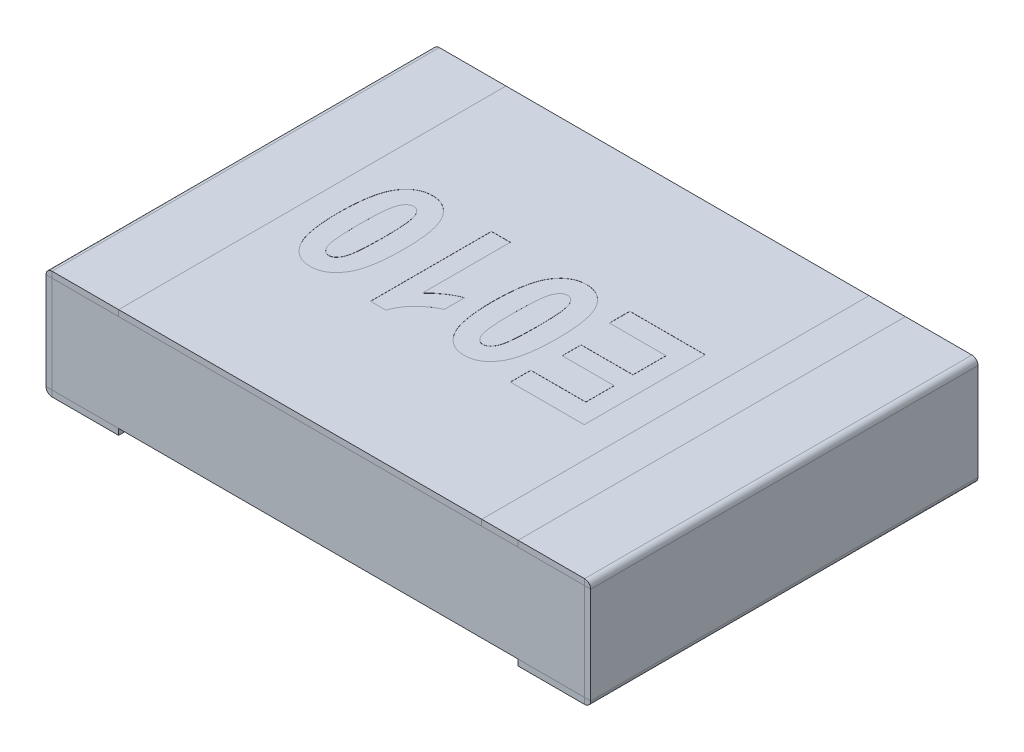
from build123d import *

# Parameters (mm, degrees)
SKETCH1_W              = 4.4
SKETCH1_H              = 3.2
BOSS_EXTRUDE1_DEPTH    = 0.8
SKETCH2_W              = 0.55
SKETCH2_H              = 3.2
BASE_FLANGE1_DEPTH     = 0.05
SM_START               = -1.6
SM_EDGE_FLANGE_1_DEPTH = 3.2
SM_EDGE_FLANGE_2_DEPTH = 3.2
SKETCH17_W             = 0.3
SKETCH17_H             = 3.2
BOSS_EXTRUDE3_DEPTH    = 0.05
SKETCH19_W             = 3
SKETCH19_H             = 3.2
BOSS_EXTRUDE4_DEPTH    = 0.05
CUT_EXTRUDE3_DEPTH     = 0.001


# Read off the part's stored shape, not the designer's step: Ребро-кромка1, Ребро-кромка2
# Sheet-metal steps are written as plain solids
with BuildPart() as part:
    # Sketch1 → Boss-Extrude1 (new body)
    with BuildSketch(Plane(origin=(0, 0.05, 0), x_dir=(1, 0, 0), z_dir=(0, 1, 0))):
        Rectangle(SKETCH1_W, SKETCH1_H)
    extrude(amount=BOSS_EXTRUDE1_DEPTH)


with BuildPart() as body_2:
    # Sketch2 → Base-Flange1 (new body)
    with BuildSketch(Plane(origin=(0, 0.05, 0), x_dir=(1, 0, 0), z_dir=(0, 1, 0))):
        with Locations((1.925, 0)):
            Rectangle(SKETCH2_W, SKETCH2_H)
    extrude(amount=-BASE_FLANGE1_DEPTH)

    # Ребро-кромка1 outline → Ребро-кромка1 (add)
    with BuildSketch(Plane.XY.offset(SM_START)):
        with BuildLine():
            Line((2.2, 0.85), (2.2, 0))
            ThreePointArc((2.2, 0), (2.235355339, 0.014644661), (2.25, 0.05))
            Line((2.25, 0.05), (2.25, 0.85))
            Line((2.25, 0.85), (2.2, 0.85))
        make_face()
    extrude(amount=SM_EDGE_FLANGE_1_DEPTH)

    # Ребро-кромка2 outline → Ребро-кромка2 (add)
    with BuildSketch(Plane.XY.offset(SM_START)):
        with BuildLine():
            Line((1.65, 0.9), (1.65, 0.85))
            Line((1.65, 0.85), (2.25, 0.85))
            ThreePointArc((2.25, 0.85), (2.235355339, 0.885355339), (2.2, 0.9))
            Line((2.2, 0.9), (1.65, 0.9))
        make_face()
    extrude(amount=SM_EDGE_FLANGE_2_DEPTH)


with BuildPart() as body_3:
    # Mirror1: mirrored copy
    add(body_2.part.mirror(Plane(origin=(0, 0, 0), x_dir=(0, 0, 1), z_dir=(1, 0, 0))))


with BuildPart() as body_4:
    # Sketch17 → Boss-Extrude3 (new body)
    with BuildSketch(Plane(origin=(0, 0.85, 0), x_dir=(1, 0, 0), z_dir=(0, 1, 0))):
        with Locations((1.5, 0)):
            Rectangle(SKETCH17_W, SKETCH17_H)
    extrude(amount=BOSS_EXTRUDE3_DEPTH)


with BuildPart() as body_5:
    # Sketch19 → Boss-Extrude4 (new body)
    with BuildSketch(Plane(origin=(0, 0.85, 0), x_dir=(1, 0, 0), z_dir=(0, 1, 0))):
        with Locations((-0.15, 0)):
            Rectangle(SKETCH19_W, SKETCH19_H)
    extrude(amount=BOSS_EXTRUDE4_DEPTH)

    # Sketch22 → Cut-Extrude3 (cut)
    # profile 1 of 4: a face of its own
    with BuildSketch(Plane(origin=(0, 0.9, 0), x_dir=(1, 0, 0), z_dir=(0, 1, 0))):
        Polygon((1.096753247, 0.5), (1.096753247, -0.5), (0.486363636, -0.5), (0.486363636, -0.331168831), (0.940909091, -0.331168831), (0.940909091, -0.097402597), (0.512337662, -0.097402597), (0.512337662, 0.058441558), (0.940909091, 0.058441558), (0.940909091, 0.331168831), (0.473376623, 0.331168831), (0.473376623, 0.5), align=None)
    # profile 2 of 4: a face of its own
    with BuildSketch(Plane(origin=(0, 0.9, 0), x_dir=(1, 0, 0), z_dir=(0, 1, 0))):
        with BuildLine():
            add(Edge.make_bspline(
                [(0.103652597, -0.5), (0.093955731, -0.499643584), (0.074821713, -0.498940299), (0.046904652, -0.493533458), (0.020327703, -0.484749305), (-0.004725518, -0.472287931), (-0.028270316, -0.456237835), (-0.050365845, -0.436696915), (-0.071029422, -0.413673545), (-0.090393937, -0.38696109), (-0.107795531, -0.355719533), (-0.122657665, -0.319386658), (-0.135139409, -0.277837017), (-0.145310216, -0.231075648), (-0.15337841, -0.179036115), (-0.158842296, -0.121713649), (-0.162321004, -0.059160988), (-0.162759194, -0.015697662), (-0.162987013, 0.006899351)],
                knots=[0, 0, 0, 0, 0.727503026, 1.435521033, 2.125933754, 2.823035237, 3.52857293, 4.258887692, 5.031802202, 5.846339271, 6.730577678, 7.709342118, 8.787052798, 9.983216815, 11.298799232, 12.737663191, 14.303878888, 16, 16, 16, 16], degree=3))
            add(Edge.make_bspline(
                [(-0.162987013, 0.006899351), (-0.162758695, 0.029428628), (-0.162319598, 0.072756585), (-0.158848652, 0.135108009), (-0.153354081, 0.192289686), (-0.14535143, 0.244208329), (-0.135058554, 0.290935837), (-0.122752776, 0.332476643), (-0.107735195, 0.368747572), (-0.090412701, 0.399961768), (-0.071012258, 0.426585681), (-0.050573687, 0.449747387), (-0.028467067, 0.469224016), (-0.00496724, 0.485213805), (0.019963493, 0.497792085), (0.046380111, 0.506449574), (0.074136084, 0.511966812), (0.093141716, 0.512642293), (0.102840909, 0.512987013)],
                knots=[0, 0, 0, 0, 1.695059366, 3.259911835, 4.697127445, 6.015833273, 7.209868934, 8.295006778, 9.271397414, 10.15773515, 10.974206064, 11.745554658, 12.477603308, 13.184816065, 13.879016739, 14.571068615, 15.270769761, 16, 16, 16, 16], degree=3))
            add(Edge.make_bspline(
                [(0.102840909, 0.512987013), (0.112532753, 0.512606133), (0.131644481, 0.511855062), (0.159621738, 0.506804683), (0.186103634, 0.497870216), (0.211281981, 0.485739024), (0.234691973, 0.469605444), (0.256862738, 0.450315631), (0.277537339, 0.427487646), (0.293272153, 0.405795033), (0.305099716, 0.386609685), (0.313351172, 0.370563652), (0.321041615, 0.353184897), (0.328444435, 0.334572066), (0.334786361, 0.314360535), (0.340910531, 0.292935141), (0.346368448, 0.270182425), (0.351191489, 0.246069015), (0.35574709, 0.220659308), (0.359225027, 0.193751396), (0.362627025, 0.165635973), (0.364891053, 0.136040328), (0.367008369, 0.105201572), (0.368313283, 0.072923768), (0.369484914, 0.039375241), (0.369482001, 0.016505494), (0.369480519, 0.00487013)],
                knots=[0, 0, 0, 0, 1.088282887, 2.146027983, 3.178826917, 4.218279349, 5.273703959, 6.361191414, 7.511779163, 8.724110884, 9.365006532, 10.041034625, 10.748217649, 11.498582071, 12.288826199, 13.125555753, 14.000603745, 14.915204017, 15.88669545, 16.898559194, 17.961282966, 19.066372579, 20.230939374, 21.432180567, 22.693579123, 24, 24, 24, 24], degree=3))
            add(Edge.make_bspline(
                [(0.369480519, 0.00487013), (0.369252863, -0.017591633), (0.36881509, -0.060784643), (0.365336578, -0.122931931), (0.359875408, -0.179849439), (0.351791747, -0.231549872), (0.341594768, -0.27809667), (0.329204045, -0.319544399), (0.314232726, -0.355761744), (0.296905262, -0.386974477), (0.277505995, -0.413598736), (0.257067137, -0.436760357), (0.234960587, -0.456237007), (0.211460743, -0.472226791), (0.186530015, -0.484805072), (0.160113396, -0.493462561), (0.132357422, -0.498979799), (0.11335179, -0.49965528), (0.103652597, -0.5)],
                knots=[0, 0, 0, 0, 1.69316225, 3.255878705, 4.690734649, 6.001855936, 7.198146525, 8.280455951, 9.258690493, 10.146702072, 10.964714887, 11.737520167, 12.470951286, 13.179499609, 13.875011277, 14.568370088, 15.269392615, 16, 16, 16, 16], degree=3))
        make_face()
        with BuildLine():
            add(Edge.make_bspline(
                [(0.103246753, -0.344155844), (0.106850708, -0.343948565), (0.114035014, -0.343535364), (0.124482557, -0.340571266), (0.134424821, -0.335856306), (0.143667114, -0.32898972), (0.152104866, -0.320150215), (0.160140258, -0.309604697), (0.167616304, -0.297156942), (0.17473207, -0.282288891), (0.181283919, -0.263745023), (0.186086444, -0.240309857), (0.190865185, -0.211907605), (0.19422938, -0.17820617), (0.197368703, -0.139384914), (0.199214431, -0.095252451), (0.200455268, -0.045935506), (0.200582508, -0.011297002), (0.200649351, 0.006899351)],
                knots=[0, 0, 0, 0, 0.441218712, 0.87954774, 1.320688601, 1.783190269, 2.281372209, 2.813490262, 3.404797085, 4.057243347, 4.830526213, 5.807711728, 6.983597402, 8.359244128, 9.955404635, 11.755826947, 13.770444526, 16, 16, 16, 16], degree=3))
            add(Edge.make_bspline(
                [(0.200649351, 0.006899351), (0.200583354, 0.025095723), (0.200457969, 0.059666644), (0.199210138, 0.108915763), (0.197369748, 0.152980735), (0.194226945, 0.191801842), (0.190878899, 0.225437253), (0.186100686, 0.253708263), (0.181241704, 0.276990444), (0.174785807, 0.295434982), (0.167577063, 0.310198121), (0.160063379, 0.322596366), (0.152243308, 0.333327103), (0.143588612, 0.341968097), (0.134434627, 0.348852599), (0.124480013, 0.353555872), (0.114035653, 0.356522982), (0.106850922, 0.35693578), (0.103246753, 0.357142857)],
                knots=[0, 0, 0, 0, 2.233925394, 4.24418983, 6.048140963, 7.647429939, 9.025772927, 10.195769628, 11.166772259, 11.941570756, 12.587815933, 13.180281715, 13.720062895, 14.213314685, 14.676722855, 15.11872835, 15.557916501, 16, 16, 16, 16], degree=3))
            add(Edge.make_bspline(
                [(0.103246753, 0.357142857), (0.099575079, 0.356940068), (0.092322747, 0.356539518), (0.081801014, 0.353567445), (0.071843179, 0.348783167), (0.062426804, 0.34205621), (0.05394986, 0.333040676), (0.045749554, 0.322539625), (0.038532732, 0.309866008), (0.031287621, 0.295125424), (0.025126139, 0.276533388), (0.020158249, 0.253313169), (0.015433992, 0.225026844), (0.012009338, 0.191473845), (0.009200198, 0.152698969), (0.007258291, 0.10871484), (0.006044615, 0.059530756), (0.005913202, 0.025027873), (0.005844156, 0.006899351)],
                knots=[0, 0, 0, 0, 0.450092843, 0.889028465, 1.330779811, 1.80063996, 2.299511324, 2.844002349, 3.431866051, 4.085215219, 4.856850318, 5.827294631, 6.996618595, 8.374169049, 9.963635982, 11.76654986, 13.775658413, 16, 16, 16, 16], degree=3))
            add(Edge.make_bspline(
                [(0.005844156, 0.006899351), (0.005913778, -0.011296779), (0.006046312, -0.045934861), (0.007251639, -0.095254644), (0.009211303, -0.139372892), (0.011995526, -0.178217419), (0.015450304, -0.211902203), (0.020167185, -0.240322958), (0.025098099, -0.263687333), (0.031285077, -0.282344247), (0.038545252, -0.297072032), (0.045681596, -0.309741109), (0.054017877, -0.320068401), (0.062419196, -0.329075108), (0.071845034, -0.335794713), (0.081800537, -0.340580804), (0.09232287, -0.343552409), (0.09957512, -0.343953023), (0.103246753, -0.344155844)],
                knots=[0, 0, 0, 0, 2.227823008, 4.240875137, 6.039898439, 7.634194999, 9.008772785, 10.183744742, 11.16017094, 11.930140898, 12.582080179, 13.168675308, 13.705450879, 14.203245709, 14.672091929, 15.112890003, 15.55087843, 16, 16, 16, 16], degree=3))
        make_face(mode=Mode.SUBTRACT)
    # profile 3 of 4: a face of its own
    with BuildSketch(Plane(origin=(0, 0.9, 0), x_dir=(1, 0, 0), z_dir=(0, 1, 0))):
        with BuildLine():
            Line((-0.669480519, 0.5), (-0.513636364, 0.5))
            Line((-0.513636364, 0.5), (-0.513636364, -0.227272727))
            add(Edge.make_bspline(
                [(-0.513636364, -0.227272727), (-0.506077623, -0.219341831), (-0.491086872, -0.203613009), (-0.467243593, -0.181646847), (-0.442479415, -0.161367105), (-0.41687979, -0.142655847), (-0.390457152, -0.125579787), (-0.363173395, -0.110095527), (-0.334991896, -0.096237189), (-0.315567085, -0.088358965), (-0.305844156, -0.084415584)],
                knots=[0, 0, 0, 0, 1.033468595, 2.049610154, 3.056309141, 4.051943378, 5.03969258, 6.022812974, 7.010335376, 8, 8, 8, 8], degree=3))
            Line((-0.305844156, -0.084415584), (-0.305844156, -0.253246753))
            add(Edge.make_bspline(
                [(-0.305844156, -0.253246753), (-0.317048972, -0.258231365), (-0.340376765, -0.268609044), (-0.37459235, -0.289391764), (-0.40894184, -0.315784897), (-0.437758064, -0.340693211), (-0.460136916, -0.362920133), (-0.475776232, -0.380676284), (-0.490237756, -0.39889626), (-0.503254225, -0.417810836), (-0.514887812, -0.437418078), (-0.525160096, -0.457625766), (-0.534286077, -0.478441893), (-0.539044726, -0.492788562), (-0.541436688, -0.5)],
                knots=[0, 0, 0, 0, 1.256134417, 2.61520085, 4.090588482, 5.69244286, 6.516065036, 7.321570443, 8.11635232, 8.89906734, 9.673136721, 10.451417408, 11.221595796, 12, 12, 12, 12], degree=3))
            Line((-0.541436688, -0.5), (-0.669480519, -0.5))
            Line((-0.669480519, -0.5), (-0.669480519, 0.5))
        make_face()
    # profile 4 of 4: a face of its own
    with BuildSketch(Plane(origin=(0, 0.9, 0), x_dir=(1, 0, 0), z_dir=(0, 1, 0))):
        with BuildLine():
            add(Edge.make_bspline(
                [(-1.169074675, -0.5), (-1.178771542, -0.499643584), (-1.19790556, -0.498940299), (-1.22582262, -0.493533458), (-1.25239957, -0.484749305), (-1.277452791, -0.472287931), (-1.300997589, -0.456237835), (-1.323093118, -0.436696915), (-1.343756695, -0.413673545), (-1.36312121, -0.38696109), (-1.380522803, -0.355719533), (-1.395384938, -0.319386658), (-1.407866682, -0.277837017), (-1.418037488, -0.231075648), (-1.426105683, -0.179036115), (-1.431569568, -0.121713649), (-1.435048277, -0.059160988), (-1.435486467, -0.015697662), (-1.435714286, 0.006899351)],
                knots=[0, 0, 0, 0, 0.727503026, 1.435521033, 2.125933754, 2.823035237, 3.52857293, 4.258887692, 5.031802202, 5.846339271, 6.730577678, 7.709342118, 8.787052798, 9.983216815, 11.298799232, 12.737663191, 14.303878888, 16, 16, 16, 16], degree=3))
            add(Edge.make_bspline(
                [(-1.435714286, 0.006899351), (-1.435485968, 0.029428628), (-1.43504687, 0.072756585), (-1.431575925, 0.135108009), (-1.426081354, 0.192289686), (-1.418078702, 0.244208329), (-1.407785827, 0.290935837), (-1.395480049, 0.332476643), (-1.380462467, 0.368747572), (-1.363139974, 0.399961768), (-1.343739531, 0.426585681), (-1.32330096, 0.449747387), (-1.301194339, 0.469224016), (-1.277694513, 0.485213805), (-1.25276378, 0.497792085), (-1.226347162, 0.506449574), (-1.198591188, 0.511966812), (-1.179585557, 0.512642293), (-1.169886364, 0.512987013)],
                knots=[0, 0, 0, 0, 1.695059366, 3.259911835, 4.697127445, 6.015833273, 7.209868934, 8.295006778, 9.271397414, 10.15773515, 10.974206064, 11.745554658, 12.477603308, 13.184816065, 13.879016739, 14.571068615, 15.270769761, 16, 16, 16, 16], degree=3))
            add(Edge.make_bspline(
                [(-1.169886364, 0.512987013), (-1.16019452, 0.512606133), (-1.141082791, 0.511855062), (-1.113105535, 0.506804683), (-1.086623638, 0.497870216), (-1.061445292, 0.485739024), (-1.0380353, 0.469605444), (-1.015864535, 0.450315631), (-0.995189934, 0.427487646), (-0.97945512, 0.405795033), (-0.967627557, 0.386609685), (-0.959376101, 0.370563652), (-0.951685658, 0.353184897), (-0.944282837, 0.334572066), (-0.937940912, 0.314360535), (-0.931816741, 0.292935141), (-0.926358825, 0.270182425), (-0.921535783, 0.246069015), (-0.916980183, 0.220659308), (-0.913502246, 0.193751396), (-0.910100248, 0.165635973), (-0.90783622, 0.136040328), (-0.905718904, 0.105201572), (-0.904413989, 0.072923768), (-0.903242359, 0.039375241), (-0.903245271, 0.016505494), (-0.903246753, 0.00487013)],
                knots=[0, 0, 0, 0, 1.088282887, 2.146027983, 3.178826917, 4.218279349, 5.273703959, 6.361191414, 7.511779163, 8.724110884, 9.365006532, 10.041034625, 10.748217649, 11.498582071, 12.288826199, 13.125555753, 14.000603745, 14.915204017, 15.88669545, 16.898559194, 17.961282966, 19.066372579, 20.230939374, 21.432180567, 22.693579123, 24, 24, 24, 24], degree=3))
            add(Edge.make_bspline(
                [(-0.903246753, 0.00487013), (-0.903474409, -0.017591633), (-0.903912183, -0.060784643), (-0.907390695, -0.122931931), (-0.912851865, -0.179849439), (-0.920935526, -0.231549872), (-0.931132504, -0.27809667), (-0.943523228, -0.319544399), (-0.958494547, -0.355761744), (-0.975822011, -0.386974477), (-0.995221278, -0.413598736), (-1.015660136, -0.436760357), (-1.037766685, -0.456237007), (-1.06126653, -0.472226791), (-1.086197258, -0.484805072), (-1.112613877, -0.493462561), (-1.140369851, -0.498979799), (-1.159375482, -0.49965528), (-1.169074675, -0.5)],
                knots=[0, 0, 0, 0, 1.69316225, 3.255878705, 4.690734649, 6.001855936, 7.198146525, 8.280455951, 9.258690493, 10.146702072, 10.964714887, 11.737520167, 12.470951286, 13.179499609, 13.875011277, 14.568370088, 15.269392615, 16, 16, 16, 16], degree=3))
        make_face()
        with BuildLine():
            add(Edge.make_bspline(
                [(-1.169480519, -0.344155844), (-1.165876565, -0.343948565), (-1.158692258, -0.343535364), (-1.148244716, -0.340571266), (-1.138302452, -0.335856306), (-1.129060158, -0.32898972), (-1.120622407, -0.320150215), (-1.112587014, -0.309604697), (-1.105110969, -0.297156942), (-1.097995203, -0.282288891), (-1.091443354, -0.263745023), (-1.086640828, -0.240309857), (-1.081862087, -0.211907605), (-1.078497893, -0.17820617), (-1.075358569, -0.139384914), (-1.073512841, -0.095252451), (-1.072272005, -0.045935506), (-1.072144764, -0.011297002), (-1.072077922, 0.006899351)],
                knots=[0, 0, 0, 0, 0.441218712, 0.87954774, 1.320688601, 1.783190269, 2.281372209, 2.813490262, 3.404797085, 4.057243347, 4.830526213, 5.807711728, 6.983597402, 8.359244128, 9.955404635, 11.755826947, 13.770444526, 16, 16, 16, 16], degree=3))
            add(Edge.make_bspline(
                [(-1.072077922, 0.006899351), (-1.072143919, 0.025095723), (-1.072269304, 0.059666644), (-1.073517134, 0.108915763), (-1.075357525, 0.152980735), (-1.078500327, 0.191801842), (-1.081848374, 0.225437253), (-1.086626587, 0.253708263), (-1.091485569, 0.276990444), (-1.097941466, 0.295434982), (-1.10515021, 0.310198121), (-1.112663894, 0.322596366), (-1.120483964, 0.333327103), (-1.129138661, 0.341968097), (-1.138292645, 0.348852599), (-1.148247259, 0.353555872), (-1.158691619, 0.356522982), (-1.165876351, 0.35693578), (-1.169480519, 0.357142857)],
                knots=[0, 0, 0, 0, 2.233925394, 4.24418983, 6.048140963, 7.647429939, 9.025772927, 10.195769628, 11.166772259, 11.941570756, 12.587815933, 13.180281715, 13.720062895, 14.213314685, 14.676722855, 15.11872835, 15.557916501, 16, 16, 16, 16], degree=3))
            add(Edge.make_bspline(
                [(-1.169480519, 0.357142857), (-1.173152194, 0.356940068), (-1.180404526, 0.356539518), (-1.190926258, 0.353567445), (-1.200884093, 0.348783167), (-1.210300468, 0.34205621), (-1.218777413, 0.333040676), (-1.226977719, 0.322539625), (-1.234194541, 0.309866008), (-1.241439651, 0.295125424), (-1.247601134, 0.276533388), (-1.252569023, 0.253313169), (-1.257293281, 0.225026844), (-1.260717935, 0.191473845), (-1.263527075, 0.152698969), (-1.265468982, 0.10871484), (-1.266682658, 0.059530756), (-1.26681407, 0.025027873), (-1.266883117, 0.006899351)],
                knots=[0, 0, 0, 0, 0.450092843, 0.889028465, 1.330779811, 1.80063996, 2.299511324, 2.844002349, 3.431866051, 4.085215219, 4.856850318, 5.827294631, 6.996618595, 8.374169049, 9.963635982, 11.76654986, 13.775658413, 16, 16, 16, 16], degree=3))
            add(Edge.make_bspline(
                [(-1.266883117, 0.006899351), (-1.266813494, -0.011296779), (-1.266680961, -0.045934861), (-1.265475634, -0.095254644), (-1.26351597, -0.139372892), (-1.260731747, -0.178217419), (-1.257276969, -0.211902203), (-1.252560087, -0.240322958), (-1.247629174, -0.263687333), (-1.241442196, -0.282344247), (-1.234182021, -0.297072032), (-1.227045677, -0.309741109), (-1.218709396, -0.320068401), (-1.210308077, -0.329075108), (-1.200882239, -0.335794713), (-1.190926736, -0.340580804), (-1.180404403, -0.343552409), (-1.173152152, -0.343953023), (-1.169480519, -0.344155844)],
                knots=[0, 0, 0, 0, 2.227823008, 4.240875137, 6.039898439, 7.634194999, 9.008772785, 10.183744742, 11.16017094, 11.930140898, 12.582080179, 13.168675308, 13.705450879, 14.203245709, 14.672091929, 15.112890003, 15.55087843, 16, 16, 16, 16], degree=3))
        make_face(mode=Mode.SUBTRACT)
    extrude(amount=-CUT_EXTRUDE3_DEPTH, mode=Mode.SUBTRACT)


solid = Compound([part.part, body_2.part, body_3.part, body_4.part, body_5.part])
